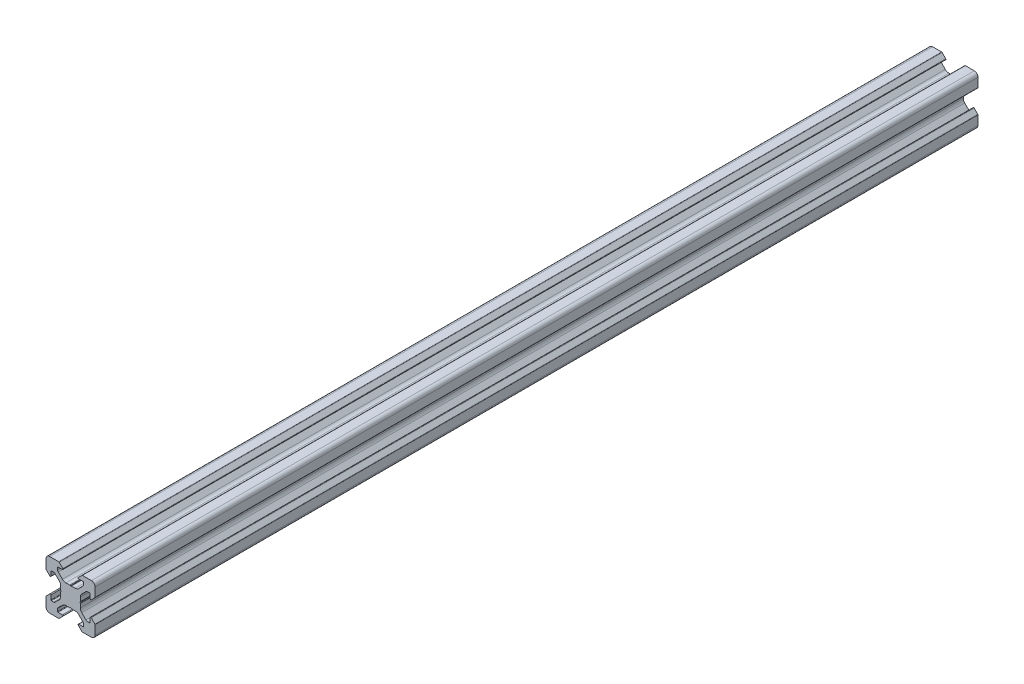
from build123d import *

# Parameters (mm, degrees)
EXTRUDE_1_DEPTH = 360


# Read off the part's stored shape, not the designer's step: 222 Конструкционный профиль 20х20-1-surface1
with BuildPart() as part:
    # Эскиз1 → Бобышка-Вытянуть1 (new body)
    with BuildSketch(Plane.XY):
        with BuildLine():
            Line((-3.945217202, 0.181521503), (-3.8, 0))
            Line((-3.8, 0), (-3.945217202, -0.181521503))
            ThreePointArc((-3.945217202, -0.181521503), (-3.98590708, -0.254943529), (-4, -0.337695265))
            Line((-4, -0.337695265), (-4, -1.898780669))
            ThreePointArc((-4, -1.898780669), (-4.152240935, -2.664147534), (-4.585786438, -3.312994231))
            Line((-4.585786438, -3.312994231), (-6.279898987, -5.007106781))
            ThreePointArc((-6.279898987, -5.007106781), (-6.604322336, -5.223879533), (-6.987005769, -5.3))
            Line((-6.987005769, -5.3), (-7.8, -5.3))
            ThreePointArc((-7.8, -5.3), (-7.941421356, -5.241421356), (-8, -5.1))
            Line((-8, -5.1), (-8, -3.33))
            ThreePointArc((-8, -3.33), (-8.154329142, -3.099030117), (-8.426776695, -3.153223305))
            Line((-8.426776695, -3.153223305), (-9.926776695, -4.653223305))
            ThreePointArc((-9.926776695, -4.653223305), (-9.980969883, -4.734329142), (-10, -4.83))
            Line((-10, -4.83), (-10, -8.5))
            ThreePointArc((-10, -8.5), (-9.560660172, -9.560660172), (-8.5, -10))
            Line((-8.5, -10), (-4.83, -10))
            ThreePointArc((-4.83, -10), (-4.734329142, -9.980969883), (-4.653223305, -9.926776695))
            Line((-4.653223305, -9.926776695), (-3.153223305, -8.426776695))
            ThreePointArc((-3.153223305, -8.426776695), (-3.099030117, -8.154329142), (-3.33, -8))
            Line((-3.33, -8), (-5.1, -8))
            ThreePointArc((-5.1, -8), (-5.241421356, -7.941421356), (-5.3, -7.8))
            Line((-5.3, -7.8), (-5.3, -6.987005769))
            ThreePointArc((-5.3, -6.987005769), (-5.223879533, -6.604322336), (-5.007106781, -6.279898987))
            Line((-5.007106781, -6.279898987), (-3.312994231, -4.585786438))
            ThreePointArc((-3.312994231, -4.585786438), (-2.664147534, -4.152240935), (-1.898780669, -4))
            Line((-1.898780669, -4), (-0.337695265, -4))
            ThreePointArc((-0.337695265, -4), (-0.254943529, -3.98590708), (-0.181521503, -3.945217202))
            Line((-0.181521503, -3.945217202), (0, -3.8))
            Line((0, -3.8), (0.181521503, -3.945217202))
            ThreePointArc((0.181521503, -3.945217202), (0.254943529, -3.98590708), (0.337695265, -4))
            Line((0.337695265, -4), (1.898780669, -4))
            ThreePointArc((1.898780669, -4), (2.664147534, -4.152240935), (3.312994231, -4.585786438))
            Line((3.312994231, -4.585786438), (5.007106781, -6.279898987))
            ThreePointArc((5.007106781, -6.279898987), (5.223879533, -6.604322336), (5.3, -6.987005769))
            Line((5.3, -6.987005769), (5.3, -7.8))
            ThreePointArc((5.3, -7.8), (5.241421356, -7.941421356), (5.1, -8))
            Line((5.1, -8), (3.33, -8))
            ThreePointArc((3.33, -8), (3.099030117, -8.154329142), (3.153223305, -8.426776695))
            Line((3.153223305, -8.426776695), (4.653223305, -9.926776695))
            ThreePointArc((4.653223305, -9.926776695), (4.734329142, -9.980969883), (4.83, -10))
            Line((4.83, -10), (8.5, -10))
            ThreePointArc((8.5, -10), (9.560660172, -9.560660172), (10, -8.5))
            Line((10, -8.5), (10, -4.83))
            ThreePointArc((10, -4.83), (9.980969883, -4.734329142), (9.926776695, -4.653223305))
            Line((9.926776695, -4.653223305), (8.426776695, -3.153223305))
            ThreePointArc((8.426776695, -3.153223305), (8.154329142, -3.099030117), (8, -3.33))
            Line((8, -3.33), (8, -5.1))
            ThreePointArc((8, -5.1), (7.941421356, -5.241421356), (7.8, -5.3))
            Line((7.8, -5.3), (6.987005769, -5.3))
            ThreePointArc((6.987005769, -5.3), (6.604322336, -5.223879533), (6.279898987, -5.007106781))
            Line((6.279898987, -5.007106781), (4.585786438, -3.312994231))
            ThreePointArc((4.585786438, -3.312994231), (4.152240935, -2.664147534), (4, -1.898780669))
            Line((4, -1.898780669), (4, -0.337695265))
            ThreePointArc((4, -0.337695265), (3.98590708, -0.254943529), (3.945217202, -0.181521503))
            Line((3.945217202, -0.181521503), (3.8, 0))
            Line((3.8, 0), (3.945217202, 0.181521503))
            ThreePointArc((3.945217202, 0.181521503), (3.98590708, 0.254943529), (4, 0.337695265))
            Line((4, 0.337695265), (4, 1.898780669))
            ThreePointArc((4, 1.898780669), (4.152240935, 2.664147534), (4.585786438, 3.312994231))
            Line((4.585786438, 3.312994231), (6.279898987, 5.007106781))
            ThreePointArc((6.279898987, 5.007106781), (6.604322336, 5.223879533), (6.987005769, 5.3))
            Line((6.987005769, 5.3), (7.8, 5.3))
            ThreePointArc((7.8, 5.3), (7.941421356, 5.241421356), (8, 5.1))
            Line((8, 5.1), (8, 3.33))
            ThreePointArc((8, 3.33), (8.154329142, 3.099030117), (8.426776695, 3.153223305))
            Line((8.426776695, 3.153223305), (9.926776695, 4.653223305))
            ThreePointArc((9.926776695, 4.653223305), (9.980969883, 4.734329142), (10, 4.83))
            Line((10, 4.83), (10, 8.5))
            ThreePointArc((10, 8.5), (9.560660172, 9.560660172), (8.5, 10))
            Line((8.5, 10), (4.83, 10))
            ThreePointArc((4.83, 10), (4.734329142, 9.980969883), (4.653223305, 9.926776695))
            Line((4.653223305, 9.926776695), (3.153223305, 8.426776695))
            ThreePointArc((3.153223305, 8.426776695), (3.099030117, 8.154329142), (3.33, 8))
            Line((3.33, 8), (5.1, 8))
            ThreePointArc((5.1, 8), (5.241421356, 7.941421356), (5.3, 7.8))
            Line((5.3, 7.8), (5.3, 6.987005769))
            ThreePointArc((5.3, 6.987005769), (5.223879533, 6.604322336), (5.007106781, 6.279898987))
            Line((5.007106781, 6.279898987), (3.312994231, 4.585786438))
            ThreePointArc((3.312994231, 4.585786438), (2.664147534, 4.152240935), (1.898780669, 4))
            Line((1.898780669, 4), (0.337695265, 4))
            ThreePointArc((0.337695265, 4), (0.254943529, 3.98590708), (0.181521503, 3.945217202))
            Line((0.181521503, 3.945217202), (0, 3.8))
            Line((0, 3.8), (-0.181521503, 3.945217202))
            ThreePointArc((-0.181521503, 3.945217202), (-0.254943529, 3.98590708), (-0.337695265, 4))
            Line((-0.337695265, 4), (-1.898780669, 4))
            ThreePointArc((-1.898780669, 4), (-2.664147534, 4.152240935), (-3.312994231, 4.585786438))
            Line((-3.312994231, 4.585786438), (-5.007106781, 6.279898987))
            ThreePointArc((-5.007106781, 6.279898987), (-5.223879533, 6.604322336), (-5.3, 6.987005769))
            Line((-5.3, 6.987005769), (-5.3, 7.8))
            ThreePointArc((-5.3, 7.8), (-5.241421356, 7.941421356), (-5.1, 8))
            Line((-5.1, 8), (-3.33, 8))
            ThreePointArc((-3.33, 8), (-3.099030117, 8.154329142), (-3.153223305, 8.426776695))
            Line((-3.153223305, 8.426776695), (-4.653223305, 9.926776695))
            ThreePointArc((-4.653223305, 9.926776695), (-4.734329142, 9.980969883), (-4.83, 10))
            Line((-4.83, 10), (-8.5, 10))
            ThreePointArc((-8.5, 10), (-9.560660172, 9.560660172), (-10, 8.5))
            Line((-10, 8.5), (-10, 4.83))
            ThreePointArc((-10, 4.83), (-9.980969883, 4.734329142), (-9.926776695, 4.653223305))
            Line((-9.926776695, 4.653223305), (-8.426776695, 3.153223305))
            ThreePointArc((-8.426776695, 3.153223305), (-8.154329142, 3.099030117), (-8, 3.33))
            Line((-8, 3.33), (-8, 5.1))
            ThreePointArc((-8, 5.1), (-7.941421356, 5.241421356), (-7.8, 5.3))
            Line((-7.8, 5.3), (-6.987005769, 5.3))
            ThreePointArc((-6.987005769, 5.3), (-6.604322336, 5.223879533), (-6.279898987, 5.007106781))
            Line((-6.279898987, 5.007106781), (-4.585786438, 3.312994231))
            ThreePointArc((-4.585786438, 3.312994231), (-4.152240935, 2.664147534), (-4, 1.898780669))
            Line((-4, 1.898780669), (-4, 0.337695265))
            ThreePointArc((-4, 0.337695265), (-3.98590708, 0.254943529), (-3.945217202, 0.181521503))
        make_face()
    extrude(amount=EXTRUDE_1_DEPTH)


solid = part.part
